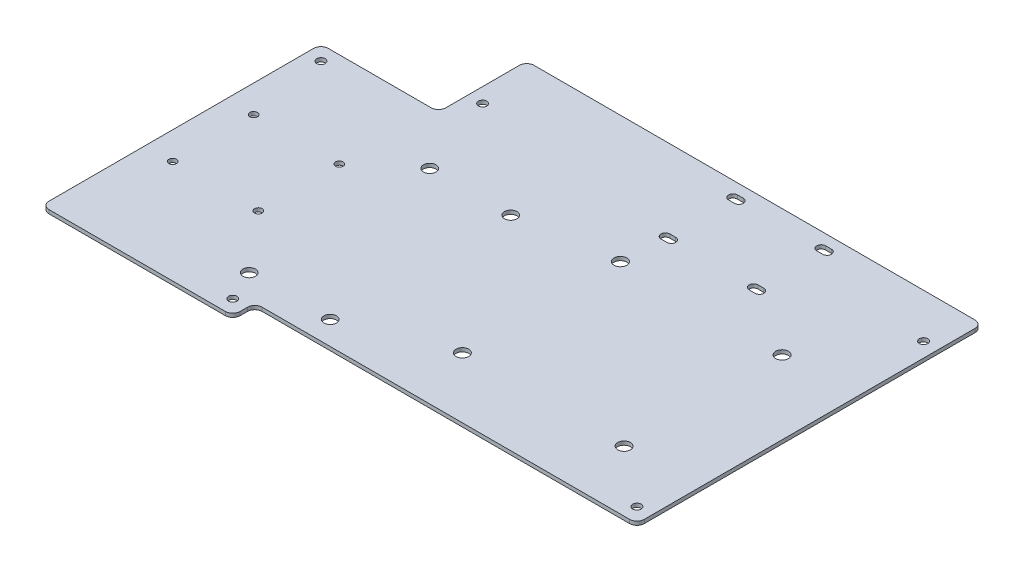
from build123d import *

# Parameters (mm, degrees)
BOSS_EXTRUDE1_DEPTH            = 1.6002
SKETCH3_W                      = 165.1
SKETCH3_H                      = 9.525
CUT_EXTRUDE1_DEPTH             = 295.167716856
FILLET1_R                      = 3.175
FUSE_ZIPTIE_MOUNTS_DEPTH       = 295.167716856
SKETCH5_R                      = 2.75
CONTACTOR_MOUNTING_HOLES_DEPTH = 295.167716856
SKETCH6_R                      = 1.8288
CUT_EXTRUDE2_DEPTH             = 295.167716856
SKETCH7_R                      = 2.7051
CUT_EXTRUDE3_DEPTH             = 295.167716856
SKETCH9_R                      = 1.65
CUT_EXTRUDE4_DEPTH             = 295.167716856


with BuildPart() as part:
    # Sketch1 → Boss-Extrude1 (new body)
    with BuildSketch(Plane(origin=(0, 0, 0), x_dir=(1, 0, 0), z_dir=(0, 1, 0))):
        Polygon((0, 120.65), (0, 0), (247.65, 0), (247.65, 158.75), (50.8, 158.75), (50.8, 120.65), align=None)
    extrude(amount=BOSS_EXTRUDE1_DEPTH)

    # Sketch3 → Cut-Extrude1 (cut, through all)
    with BuildSketch(Plane(origin=(0, 1.6002, 0), x_dir=(1, 0, 0), z_dir=(0, 1, 0))):
        with Locations((165.1, 4.7625)):
            Rectangle(SKETCH3_W, SKETCH3_H)
    extrude(amount=-CUT_EXTRUDE1_DEPTH, mode=Mode.SUBTRACT)

    # Fillet1
    fillet1_edges = [part.edges().sort_by_distance(p)[0] for p in [
        (82.55, 0.8001, 0),
        (0, 0.8001, -120.65),
        (50.8, 0.8001, -120.65),
        (50.8, 0.8001, -158.75),
        (247.65, 0.8001, -158.75),
        (247.65, 0.8001, -9.525),
        (82.55, 0.8001, -9.525),
        (0, 0.8001, 0),
    ]]
    fillet(fillet1_edges, radius=FILLET1_R)

    # Sketch4 → Fuse Ziptie Mounts (cut, through all)
    with BuildSketch(Plane(origin=(0, 1.6002, 0), x_dir=(1, 0, 0), z_dir=(0, 1, 0))):
        with BuildLine():
            Line((146.365, 154.225), (148.905, 154.225))
            ThreePointArc((148.905, 154.225), (150.81, 152.32), (148.905, 150.415))
            Line((148.905, 150.415), (146.365, 150.415))
            ThreePointArc((146.365, 150.415), (144.46, 152.32), (146.365, 154.225))
        make_face()
        with BuildLine():
            Line((184.465, 154.225), (187.005, 154.225))
            ThreePointArc((187.005, 154.225), (188.91, 152.32), (187.005, 150.415))
            Line((187.005, 150.415), (184.465, 150.415))
            ThreePointArc((184.465, 150.415), (182.56, 152.32), (184.465, 154.225))
        make_face()
        with BuildLine():
            Line((184.465, 125.015), (187.005, 125.015))
            ThreePointArc((187.005, 125.015), (188.91, 123.11), (187.005, 121.205))
            Line((187.005, 121.205), (184.465, 121.205))
            ThreePointArc((184.465, 121.205), (182.56, 123.11), (184.465, 125.015))
        make_face()
        with BuildLine():
            Line((146.365, 125.015), (148.905, 125.015))
            ThreePointArc((148.905, 125.015), (150.81, 123.11), (148.905, 121.205))
            Line((148.905, 121.205), (146.365, 121.205))
            ThreePointArc((146.365, 121.205), (144.46, 123.11), (146.365, 125.015))
        make_face()
    extrude(amount=-FUSE_ZIPTIE_MOUNTS_DEPTH, mode=Mode.SUBTRACT)

    # Sketch5 → Contactor Mounting Holes (cut, through all)
    with BuildSketch(Plane(origin=(0, 1.6002, 0), x_dir=(1, 0, 0), z_dir=(0, 1, 0))):
        with Locations((146.05, 103.9876)):
            Circle(SKETCH5_R)
        with Locations((146.05, 35.7124)):
            Circle(SKETCH5_R)
        with Locations((215.9, 103.9876)):
            Circle(SKETCH5_R)
        with Locations((215.9, 35.7124)):
            Circle(SKETCH5_R)
    extrude(amount=-CONTACTOR_MOUNTING_HOLES_DEPTH, mode=Mode.SUBTRACT)

    # Sketch6 → Cut-Extrude2 (cut, through all)
    with BuildSketch(Plane(origin=(0, 1.6002, 0), x_dir=(1, 0, 0), z_dir=(0, 1, 0))):
        with Locations((6.35, 114.3)):
            Circle(SKETCH6_R)
        with Locations((76.2, 6.35)):
            Circle(SKETCH6_R)
        with Locations((241.3, 15.875)):
            Circle(SKETCH6_R)
        with Locations((241.3, 139.7)):
            Circle(SKETCH6_R)
        with Locations((57.15, 133.35)):
            Circle(SKETCH6_R)
    extrude(amount=-CUT_EXTRUDE2_DEPTH, mode=Mode.SUBTRACT)

    # Sketch7 → Cut-Extrude3 (cut, through all)
    with BuildSketch(Plane(origin=(0, 1.6002, 0), x_dir=(1, 0, 0), z_dir=(0, 1, 0))):
        with Locations((104.999998364, 19.649998364)):
            Circle(SKETCH7_R)
        with Locations((69.999998364, 19.649998364)):
            Circle(SKETCH7_R)
        with Locations((104.999998364, 97.649998364)):
            Circle(SKETCH7_R)
        with Locations((69.999998364, 97.649998364)):
            Circle(SKETCH7_R)
    extrude(amount=-CUT_EXTRUDE3_DEPTH, mode=Mode.SUBTRACT)

    # Sketch9 → Cut-Extrude4 (cut, through all)
    with BuildSketch(Plane(origin=(0, 1.6002, 0), x_dir=(1, 0, 0), z_dir=(0, 1, 0))):
        with Locations((11.85, 79.75)):
            Circle(SKETCH9_R)
        with Locations((11.85, 44.75)):
            Circle(SKETCH9_R)
        with Locations((48.85, 79.75)):
            Circle(SKETCH9_R)
        with Locations((48.85, 44.75)):
            Circle(SKETCH9_R)
    extrude(amount=-CUT_EXTRUDE4_DEPTH, mode=Mode.SUBTRACT)


solid = part.part
